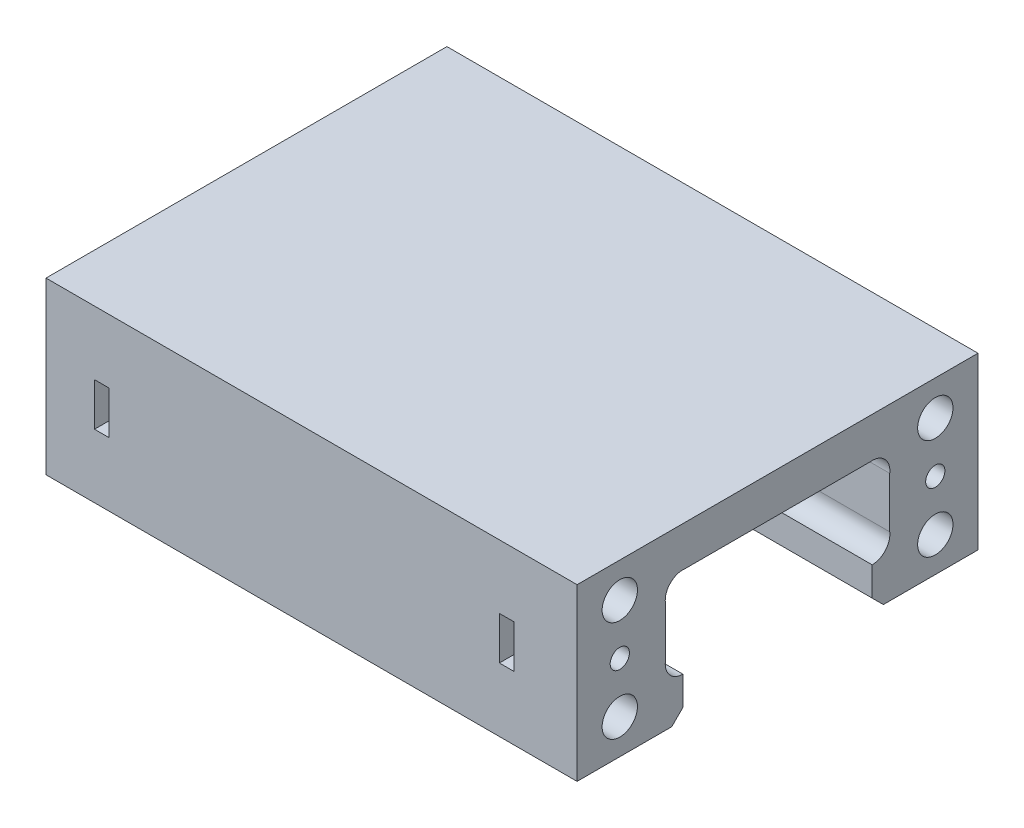
from build123d import *

# Parameters (mm, degrees)
SKETCH2_R           = 2.778125
BOSS_EXTRUDE2_DEPTH = 84.1648256
SKETCH3_R           = 1.524
CUT_EXTRUDE1_DEPTH  = 19.1668
SKETCH4_W           = 9.860217
SKETCH4_H           = 2.3114
CUT_EXTRUDE2_DEPTH  = 3.4036
SKETCH5_R           = 2.8
CUT_EXTRUDE3_DEPTH  = 102.507936795


with BuildPart() as part:
    # Sketch2 → Boss-Extrude2 (new body)
    with BuildSketch(Plane(origin=(0, 0, 0), x_dir=(0, 0, -1), z_dir=(1, 0, 0))):
        with BuildLine():
            Line((0, 25.778125), (30, 25.778125))
            ThreePointArc((30, 25.778125), (31.964431026, 24.964431026), (32.778125, 23))
            Line((32.778125, 23), (32.778125, 14.278125))
            ThreePointArc((32.778125, 14.278125), (31.964431026, 12.313693974), (30, 11.5))
            Line((30, 11.5), (30, 6.906829453))
            Line((30, 6.906829453), (31.767766953, 5.1390625))
            Line((31.767766953, 5.1390625), (46.767766953, 5.1390625))
            Line((46.767766953, 5.1390625), (46.767766953, 32.1390625))
            Line((46.767766953, 32.1390625), (-16.767766953, 32.1390625))
            Line((-16.767766953, 32.1390625), (-16.767766953, 5.1390625))
            Line((-16.767766953, 5.1390625), (-1.767766953, 5.1390625))
            Line((-1.767766953, 5.1390625), (0, 6.906829453))
            Line((0, 6.906829453), (0, 11.5))
            ThreePointArc((0, 11.5), (-1.964431026, 12.313693974), (-2.778125, 14.278125))
            Line((-2.778125, 14.278125), (-2.778125, 23))
            ThreePointArc((-2.778125, 23), (-1.964431026, 24.964431026), (0, 25.778125))
        make_face()
        with Locations((-10, 26.6390625)):
            Circle(SKETCH2_R, mode=Mode.SUBTRACT)
        with Locations((-10, 10.6390625)):
            Circle(SKETCH2_R, mode=Mode.SUBTRACT)
        with Locations((40, 10.6390625)):
            Circle(SKETCH2_R, mode=Mode.SUBTRACT)
        with Locations((40, 26.6390625)):
            Circle(SKETCH2_R, mode=Mode.SUBTRACT)
    extrude(amount=BOSS_EXTRUDE2_DEPTH)

    # Sketch3 → Cut-Extrude1 (cut)
    with BuildSketch(Plane(origin=(84.1648256, 0, 0), x_dir=(0, 0, -1), z_dir=(1, 0, 0))):
        with Locations((-10, 18.6390625)):
            Circle(SKETCH3_R)
        with Locations((40, 18.6390625)):
            Circle(SKETCH3_R)
    cut_extrude1 = extrude(amount=-CUT_EXTRUDE1_DEPTH, mode=Mode.SUBTRACT)

    # Mirror1: Cut-Extrude1 across plane
    add(cut_extrude1.mirror(Plane(origin=(42.0824128, 0, 0), x_dir=(0, 0, 1), z_dir=(1, 0, 0))), mode=Mode.SUBTRACT)

    # Sketch4 → Cut-Extrude2 (cut, symmetric)
    with BuildSketch(Plane(origin=(0, 18.6390625, 0), x_dir=(0, 0, -1), z_dir=(0, -1, 0))):
        with Locations((-11.837658453, 73.0091256)):
            Rectangle(SKETCH4_W, SKETCH4_H)
        with Locations((41.837658453, 73.0091256)):
            Rectangle(SKETCH4_W, SKETCH4_H)
        with Locations((-11.837658453, 8.8443)):
            Rectangle(SKETCH4_W, SKETCH4_H)
        with Locations((41.837658453, 8.8443)):
            Rectangle(SKETCH4_W, SKETCH4_H)
    extrude(amount=CUT_EXTRUDE2_DEPTH, both=True, mode=Mode.SUBTRACT)

    # Sketch5 → Cut-Extrude3 (cut, through all)
    with BuildSketch(Plane(origin=(84.1648256, 0, 0), x_dir=(0, 0, -1), z_dir=(1, 0, 0))):
        with Locations((-10, 26.6390625)):
            Circle(SKETCH5_R)
        with Locations((0, 23)):
            Circle(SKETCH5_R)
        with Locations((-10, 10.6390625)):
            Circle(SKETCH5_R)
        with Locations((40, 26.6390625)):
            Circle(SKETCH5_R)
        with Locations((40, 10.6390625)):
            Circle(SKETCH5_R)
        with Locations((30, 23)):
            Circle(SKETCH5_R)
        with Locations((0, 14.278125)):
            Circle(SKETCH5_R)
        with Locations((30, 14.278125)):
            Circle(SKETCH5_R)
    extrude(amount=-CUT_EXTRUDE3_DEPTH, mode=Mode.SUBTRACT)


solid = part.part
